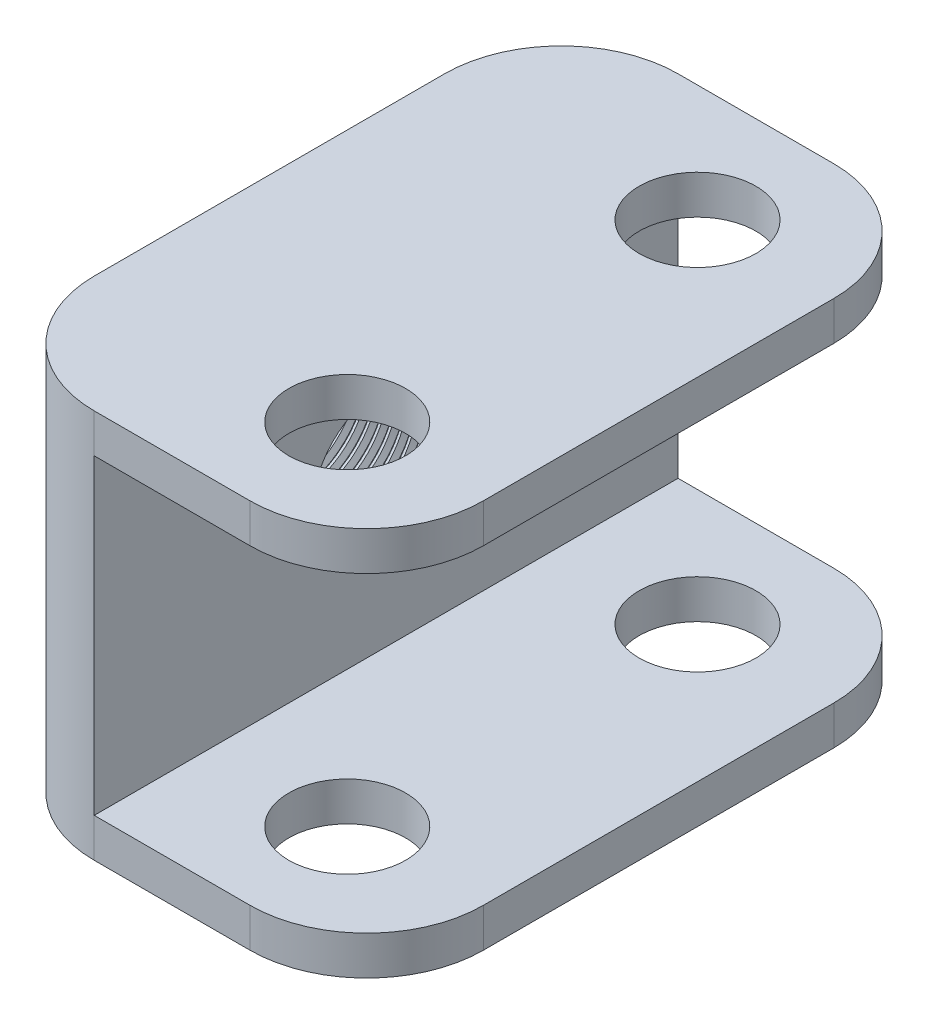
from build123d import *
from build123d.topology import SkipClean

# Parameters (mm, degrees)
BOSS_EXTRUDE1_DEPTH = 150
SKETCH2_R           = 15
CUT_EXTRUDE1_DEPTH  = 150
FILLET1_R           = 30
SKETCH3_R           = 18
CUT_EXTRUDE2_DEPTH  = 150
THREAD1_PITCH       = 2.5


with BuildPart() as part:
    # Sketch1 → Boss-Extrude1 (new body)
    with BuildSketch(Plane.XY):
        Polygon((0, 0), (30, 0), (100, 0), (100, 10), (30, 10), (30, 90), (100, 90), (100, 100), (30, 100), (0, 100), align=None)
    extrude(amount=BOSS_EXTRUDE1_DEPTH)

    # Sketch2 → Cut-Extrude1 (cut)
    with BuildSketch(Plane(origin=(0, 100, 0), x_dir=(1, 0, 0), z_dir=(0, 1, 0))):
        with Locations(Location((65, -30, 0), (0, 0, 270))):
            Circle(SKETCH2_R)
        with Locations(Location((65, -120, 0), (0, 0, 270))):
            Circle(SKETCH2_R)
    extrude(amount=-CUT_EXTRUDE1_DEPTH, mode=Mode.SUBTRACT)

    # Fillet1
    fillet1_edges = [part.edges().sort_by_distance(p)[0] for p in [
        (100, 5, 150),
        (100, 95, 0),
        (100, 5, 0),
        (100, 95, 150),
        (0, 50, 150),
        (0, 50, 0),
    ]]
    fillet(fillet1_edges, radius=FILLET1_R - 0.0001)  # a hair under: the kernel refuses the full size

    # Sketch3 → Cut-Extrude2 (cut)
    with BuildSketch(Plane.ZY):
        with Locations((75, 50)):
            Circle(SKETCH3_R)
    extrude(amount=-CUT_EXTRUDE2_DEPTH, mode=Mode.SUBTRACT)

    # Thread1: the profile of Thread Profile1 profile screwed along a right-hand helix of 12 turns, 10 arcs to a turn; built about Z, then put on its axis
    with SkipClean():  # the faces are left unmerged after this step: merging them gives an invalid solid
        thread1_z = Axis((0, 0, 0), (0, 0, 1))
        thread1_corners = [(17.9997, 0, -0.000173205), (19.353164688, 0, 0.781249997), (19.353164688, 0, 1.093749997), (17.9997, 0, 1.875173198)]
        with BuildLine(mode=Mode.PRIVATE) as thread1_profile:
            Line(thread1_corners[0], thread1_corners[1])
            Line(thread1_corners[1], thread1_corners[2])
            Line(thread1_corners[2], thread1_corners[3])
            Line(thread1_corners[3], thread1_corners[0])
        thread1_cap = Face(thread1_profile.wire())
        thread1_turn_angles = [0, 18, 36, 54, 72, 90, 108, 126, 144, 162, 180, 198, 216, 234, 252, 270, 288, 306, 324, 342, 360]
        thread1_turn_weights = [1, 0.9510565162951535, 1, 0.9510565162951535, 1, 0.9510565162951535, 1, 0.9510565162951535, 1, 0.9510565162951535, 1, 0.9510565162951535, 1, 0.9510565162951535, 1, 0.9510565162951535, 1, 0.9510565162951535, 1, 0.9510565162951535, 1]
        thread1_turn_rails = [Edge.make_bspline([Vector(p[0], p[1], 0).rotate(thread1_z, thread1_turn_angles[k]) / thread1_turn_weights[k] + Vector(0, 0, p[2] + THREAD1_PITCH * thread1_turn_angles[k] / 360) for k in range(21)], [0, 0, 0, 1, 1, 2, 2, 3, 3, 4, 4, 5, 5, 6, 6, 7, 7, 8, 8, 9, 9, 10, 10, 10], 2, thread1_turn_weights) for p in thread1_corners]
        thread1_turn_sides = [Face.make_surface_from_curves(thread1_turn_rails[p[0]], thread1_turn_rails[p[1]]) for p in [(0, 1), (1, 2), (2, 3), (3, 0)]]
        thread1 = Plane(origin=(0, 50, 75), x_dir=(0, 0, -1), z_dir=(1, 0, 0)) * Solid(Shell([*[p.moved(Location((0, 0, THREAD1_PITCH * i))) for i in range(12) for p in thread1_turn_sides], thread1_cap, thread1_cap.rotate(thread1_z, 4320).moved(Location((0, 0, THREAD1_PITCH * 4320 / 360)))]))
        add(thread1, mode=Mode.SUBTRACT)

    # Sketch13 → Cut-Revolve1 (revolve, cut)
    with BuildSketch(Plane(origin=(0, 50, 0), x_dir=(1, 0, 0), z_dir=(0, 1, 0))):
        Polygon((1.093749997, -55.646835312), (0.781249997, -55.646835312), (0, -57), (1.874999993, -57), align=None)
    revolve(axis=Axis((150, 50, 75), (-1, 0, 0)), mode=Mode.SUBTRACT)


solid = part.part
